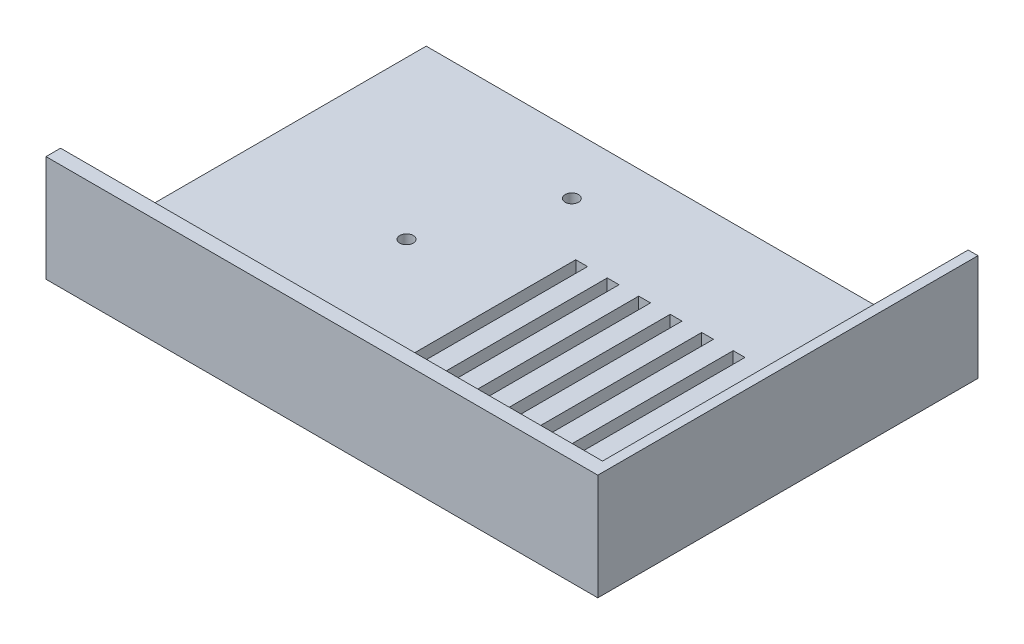
from build123d import *

# Parameters (mm, degrees)
SKETCH1_W                     = 280.4
SKETCH1_H                     = 193.2
SHELL_BLOCK_DEPTH             = 27
SKETCH2_W                     = 275.4
SKETCH2_H                     = 185.8
FRONT_OPENING_DEPTH           = 1.5
SKETCH3_W                     = 275.4
SKETCH3_H                     = 188.2
DISPLAY_POCKET_DEPTH          = 22.5
SKETCH4_W                     = 3
SKETCH4_H                     = 56
VENT_SLOTS_DEPTH              = 4
SKETCH5_W                     = 70
SKETCH5_H                     = 16
CABLE_EXIT_X_SHORT_SIDE_DEPTH = 141.2
SKETCH6_R                     = 1.7
BOLT_HOLES_DEPTH              = 4
KEEP_ONE_HALF_X_DEPTH         = 173.385034153
KEEP_ONE_HALF_X_DEPTH_BACK    = 173.385034153
SKETCH7_W                     = 200
SKETCH7_H                     = 400
KEEP_ONE_QUARTER_Z_DEPTH      = 173.385034153
KEEP_ONE_QUARTER_Z_DEPTH_BACK = 173.385034153
SKETCH8_W                     = 400
SKETCH8_H                     = 200


with BuildPart() as part:
    # Sketch1 → Shell Block (new body)
    with BuildSketch(Plane(origin=(0, 0, 0), x_dir=(1, 0, 0), z_dir=(0, 1, 0))):
        Rectangle(SKETCH1_W, SKETCH1_H)
    extrude(amount=SHELL_BLOCK_DEPTH)

    # Sketch2 → Front Opening (cut)
    with BuildSketch(Plane(origin=(0, 27, 0), x_dir=(1, 0, 0), z_dir=(0, 1, 0))):
        Rectangle(SKETCH2_W, SKETCH2_H)
    extrude(amount=-FRONT_OPENING_DEPTH, mode=Mode.SUBTRACT)

    # Sketch3 → Display Pocket (cut)
    with BuildSketch(Plane(origin=(0, 25.5, 0), x_dir=(1, 0, 0), z_dir=(0, 1, 0))):
        Rectangle(SKETCH3_W, SKETCH3_H)
    extrude(amount=-DISPLAY_POCKET_DEPTH, mode=Mode.SUBTRACT)

    # Sketch4 → Vent Slots (cut)
    with BuildSketch(Plane(origin=(0, 3, 0), x_dir=(1, 0, 0), z_dir=(0, 1, 0))):
        with Locations((67.5, 56)):
            Rectangle(SKETCH4_W, SKETCH4_H)
        with Locations((67.5, -56)):
            Rectangle(SKETCH4_W, SKETCH4_H)
        with Locations((75.5, 56)):
            Rectangle(SKETCH4_W, SKETCH4_H)
        with Locations((75.5, -56)):
            Rectangle(SKETCH4_W, SKETCH4_H)
        with Locations((83.5, 56)):
            Rectangle(SKETCH4_W, SKETCH4_H)
        with Locations((83.5, -56)):
            Rectangle(SKETCH4_W, SKETCH4_H)
        with Locations((91.5, 56)):
            Rectangle(SKETCH4_W, SKETCH4_H)
        with Locations((91.5, -56)):
            Rectangle(SKETCH4_W, SKETCH4_H)
        with Locations((99.5, 56)):
            Rectangle(SKETCH4_W, SKETCH4_H)
        with Locations((99.5, -56)):
            Rectangle(SKETCH4_W, SKETCH4_H)
        with Locations((107.5, 56)):
            Rectangle(SKETCH4_W, SKETCH4_H)
        with Locations((107.5, -56)):
            Rectangle(SKETCH4_W, SKETCH4_H)
        with Locations((115.5, 56)):
            Rectangle(SKETCH4_W, SKETCH4_H)
        with Locations((115.5, -56)):
            Rectangle(SKETCH4_W, SKETCH4_H)
        with Locations((123.5, 56)):
            Rectangle(SKETCH4_W, SKETCH4_H)
        with Locations((123.5, -56)):
            Rectangle(SKETCH4_W, SKETCH4_H)
    extrude(amount=-VENT_SLOTS_DEPTH, mode=Mode.SUBTRACT)

    # Sketch5 → Cable Exit (+X short side) (cut)
    with BuildSketch(Plane(origin=(0, 0, 0), x_dir=(0, 0, -1), z_dir=(1, 0, 0))):
        with Locations((0, 13)):
            Rectangle(SKETCH5_W, SKETCH5_H)
    extrude(amount=-CABLE_EXIT_X_SHORT_SIDE_DEPTH, mode=Mode.SUBTRACT)

    # Sketch6 → Bolt Holes (cut)
    with BuildSketch(Plane(origin=(0, 3, 0), x_dir=(1, 0, 0), z_dir=(0, 1, 0))):
        with Locations((-40, -45)):
            Circle(SKETCH6_R)
        with Locations((-40, 45)):
            Circle(SKETCH6_R)
        with Locations((40, -45)):
            Circle(SKETCH6_R)
        with Locations((40, 45)):
            Circle(SKETCH6_R)
        with Locations((-52, -15)):
            Circle(SKETCH6_R)
        with Locations((-52, 15)):
            Circle(SKETCH6_R)
        with Locations((52, -15)):
            Circle(SKETCH6_R)
        with Locations((52, 15)):
            Circle(SKETCH6_R)
        with Locations((-12, -82)):
            Circle(SKETCH6_R)
        with Locations((-12, 82)):
            Circle(SKETCH6_R)
        with Locations((12, -82)):
            Circle(SKETCH6_R)
        with Locations((12, 82)):
            Circle(SKETCH6_R)
        with Locations((-124, -12)):
            Circle(SKETCH6_R)
        with Locations((-124, 12)):
            Circle(SKETCH6_R)
        with Locations((124, -12)):
            Circle(SKETCH6_R)
        with Locations((124, 12)):
            Circle(SKETCH6_R)
    extrude(amount=-BOLT_HOLES_DEPTH, mode=Mode.SUBTRACT)

    # Sketch7 → Keep one half (X) (cut, two sides: drawn at the far end of the back side and taken through both)
    with BuildSketch(Plane(origin=(0, 0, 0), x_dir=(1, 0, 0), z_dir=(0, 1, 0)).offset(-KEEP_ONE_HALF_X_DEPTH_BACK)):
        with Locations((-100, 0)):
            Rectangle(SKETCH7_W, SKETCH7_H)
    extrude(amount=KEEP_ONE_HALF_X_DEPTH + KEEP_ONE_HALF_X_DEPTH_BACK, mode=Mode.SUBTRACT)

    # Sketch8 → Keep one quarter (Z) (cut, two sides: drawn at the far end of the back side and taken through both)
    with BuildSketch(Plane(origin=(0, 0, 0), x_dir=(1, 0, 0), z_dir=(0, 1, 0)).offset(-KEEP_ONE_QUARTER_Z_DEPTH_BACK)):
        with Locations((0, 100)):
            Rectangle(SKETCH8_W, SKETCH8_H)
    extrude(amount=KEEP_ONE_QUARTER_Z_DEPTH + KEEP_ONE_QUARTER_Z_DEPTH_BACK, mode=Mode.SUBTRACT)


solid = part.part
